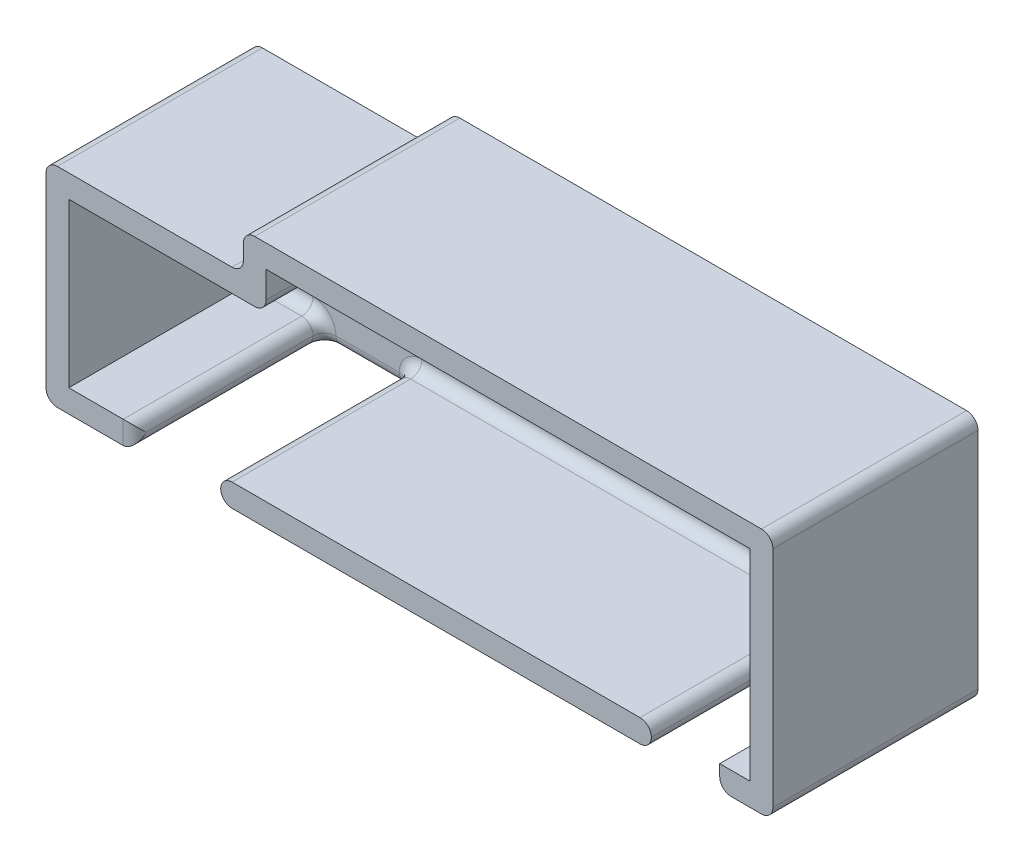
from build123d import *

# Parameters (mm, degrees)
BOSS_EXTRUDE1_DEPTH     = 4
BOSS_EXTRUDE2_DEPTH     = 50
CUT_EXTRUDE1_DEPTH      = 677.427541211
CUT_EXTRUDE1_DEPTH_BACK = 50
SKETCH3_W               = 22.667747696
SKETCH3_H               = 6
SKETCH3_W_2             = 18
FILLET3_R               = 3


with BuildPart() as part:
    # Sketch1 → Boss-Extrude1 (new body)
    with BuildSketch(Plane.XY.offset(-724.191392871)):
        Polygon((476.461364297, 467.098298929), (476.461364297, 412.098298929), (285.063110998, 412.098298929), (285.063110998, 467.098298929), (337.030633325, 467.098298929), (337.030633325, 477.098298929), (476.461364297, 477.098298929), align=None)
    extrude(amount=BOSS_EXTRUDE1_DEPTH)

    # Sketch2 → Boss-Extrude2 (add)
    with BuildSketch(Plane.XY.offset(-720.191392871)):
        Polygon((285.063110998, 467.098298929), (285.063110998, 412.098298929), (476.461364297, 412.098298929), (476.461364297, 477.098298929), (337.030633325, 477.098298929), (337.030633325, 467.098298929), align=None)
        Polygon((291.063110998, 461.098298929), (343.030633325, 461.098298929), (343.030633325, 471.098298929), (470.461364297, 471.098298929), (470.461364297, 418.098298929), (291.063110998, 418.098298929), align=None, mode=Mode.SUBTRACT)
    extrude(amount=BOSS_EXTRUDE2_DEPTH)

    # Sketch3 → Cut-Extrude1 (cut, two sides: drawn at the far end of the back side and taken through both)
    with BuildSketch(Plane.XY.offset(-670.191392871).offset(-CUT_EXTRUDE1_DEPTH_BACK)):
        with Locations((319.72923715, 415.098298929)):
            Rectangle(SKETCH3_W, SKETCH3_H)
        with Locations((453.461364297, 415.098298929)):
            Rectangle(SKETCH3_W_2, SKETCH3_H)
    extrude(amount=CUT_EXTRUDE1_DEPTH + CUT_EXTRUDE1_DEPTH_BACK, mode=Mode.SUBTRACT)

    # Fillet3
    fillet3_edges = [part.edges().sort_by_distance(p)[0] for p in [
        (337.030633325, 477.098298929, -697.191392871),
        (476.461364297, 477.098298929, -697.191392871),
        (476.461364297, 412.098298929, -697.191392871),
        (285.063110998, 412.098298929, -697.191392871),
        (285.063110998, 467.098298929, -697.191392871),
        (337.030633325, 467.098298929, -697.191392871),
        (343.030633325, 461.098298929, -695.191392871),
        (406.745998811, 471.098298929, -720.191392871),
        (343.030633325, 466.098298929, -720.191392871),
        (317.046872162, 461.098298929, -720.191392871),
        (299.72923715, 418.098298929, -720.191392871),
        (470.461364297, 444.598298929, -720.191392871),
        (387.762237648, 418.098298929, -720.191392871),
        (466.461364297, 418.098298929, -720.191392871),
        (308.395363302, 415.098298929, -670.191392871),
        (331.063110998, 418.098298929, -695.191392871),
        (331.063110998, 415.098298929, -720.191392871),
        (331.063110998, 412.098298929, -695.191392871),
        (308.395363302, 412.098298929, -695.191392871),
        (308.395363302, 418.098298929, -695.191392871),
        (319.72923715, 412.098298929, -720.191392871),
        (308.395363302, 415.098298929, -720.191392871),
        (444.461364297, 412.098298929, -695.191392871),
        (444.461364297, 415.098298929, -720.191392871),
        (444.461364297, 418.098298929, -695.191392871),
        (462.461364297, 412.098298929, -695.191392871),
        (462.461364297, 415.098298929, -720.191392871),
        (453.461364297, 412.098298929, -720.191392871),
    ]]
    fillet(fillet3_edges, radius=FILLET3_R - 0.0001)  # a hair under: the kernel refuses the full size


solid = part.part
